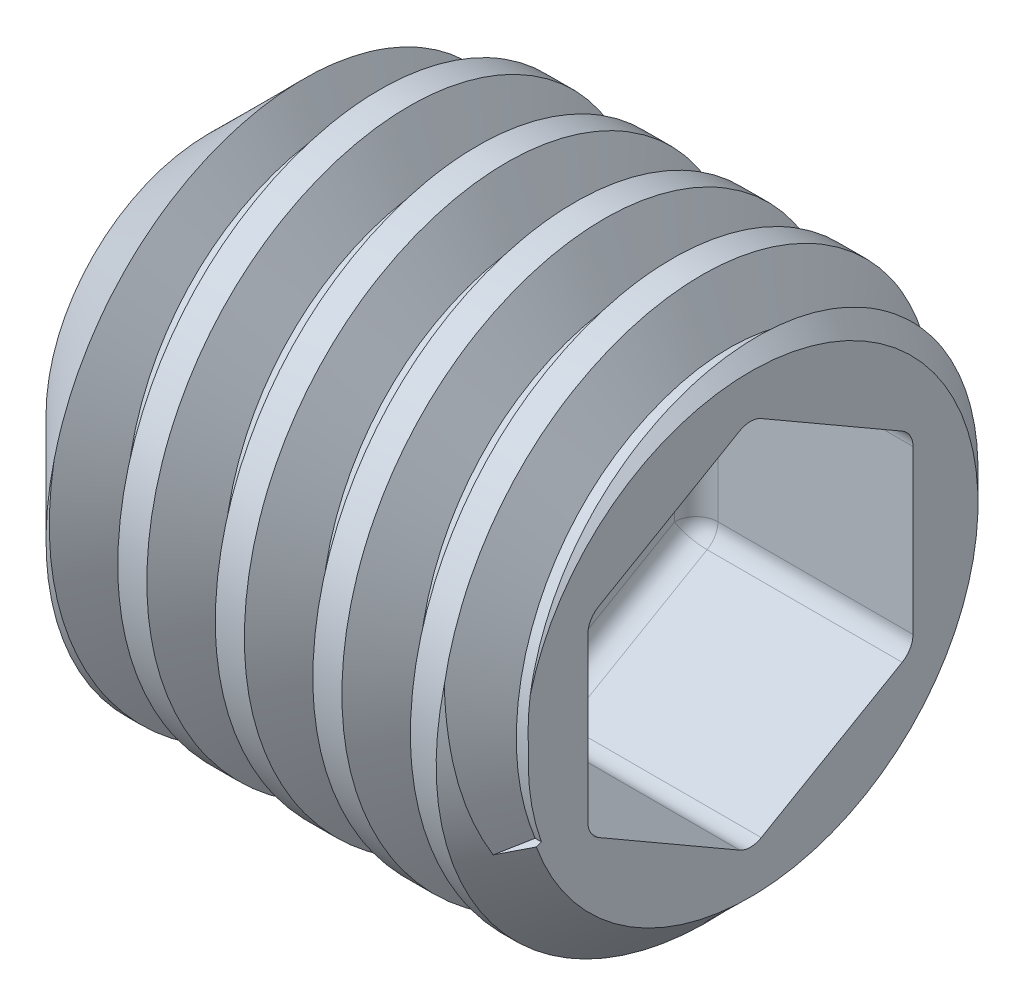
from build123d import *

# Parameters (mm, degrees)
CORTE_EXTRUS_O1_DEPTH     = 1
FILETE1_R                 = 0.1
VARREDURA_DE_CORTE1_PITCH = 0.45


with BuildPart() as part:
    # Esboço1 → Revolução1 (revolve)
    with BuildSketch(Plane.XY, mode=Mode.PRIVATE) as revolu_o1_sk:
        Polygon((0, 0), (2.5, 0), (2.5, 1.05), (2.3, 1.25), (0.5, 1.25), (0, 0.75), align=None)
    revolve(revolu_o1_sk.sketch.rotate(Axis((0, 0, 0), (-1, 0, 0)), 90), axis=Axis((0, 0, 0), (-1, 0, 0)))

    # Esboço2 → Corte-extrusão1 (cut)
    with BuildSketch(Plane(origin=(2.5, 0, 0), x_dir=(0, 0, -1), z_dir=(1, 0, 0))):
        Polygon((0, 0.866025404), (-0.75, 0.433012702), (-0.75, -0.433012702), (0, -0.866025404), (0.75, -0.433012702), (0.75, 0.433012702), align=None)
    extrude(amount=-CORTE_EXTRUS_O1_DEPTH, mode=Mode.SUBTRACT)

    # Filete1
    filete1_edges = [part.edges().sort_by_distance(p)[0] for p in [
        (1.5, 0.649519053, -0.375),
        (2, 0.866025404, 0),
        (1.5, 0, -0.75),
        (2, 0.433012702, -0.75),
        (1.5, -0.649519053, -0.375),
        (2, -0.433012702, -0.75),
        (1.5, -0.649519053, 0.375),
        (2, -0.866025404, 0),
        (1.5, 0, 0.75),
        (2, -0.433012702, 0.75),
        (1.5, 0.649519053, 0.375),
        (2, 0.433012702, 0.75),
    ]]
    fillet(filete1_edges, radius=FILETE1_R)

    # Varredura de corte1: arcs per turn and ends read off the stored shape
    # Varredura de corte1: the profile of Esboço4 profile screwed along a right-hand helix through 5.554978 turns, 6 arcs to a turn; built about Z, then put on its axis
    varredura_de_corte1_z = Axis((0, 0, 0), (0, 0, 1))
    varredura_de_corte1_corners = [(1.025, 0, 0.028125), (1.025, 0, -0.028125), (1.2503, 0, -0.158202016), (1.2497, 0, -0.214278811), (1.285906861, 0, -0.214278811), (1.285906861, 0, 0.214278811), (1.25, 0, 0.214278811), (1.25, 0, 0.158028811)]
    with BuildLine(mode=Mode.PRIVATE) as varredura_de_corte1_profile:
        Line(varredura_de_corte1_corners[0], varredura_de_corte1_corners[1])
        Line(varredura_de_corte1_corners[1], varredura_de_corte1_corners[2])
        Line(varredura_de_corte1_corners[2], varredura_de_corte1_corners[3])
        Line(varredura_de_corte1_corners[3], varredura_de_corte1_corners[4])
        Line(varredura_de_corte1_corners[4], varredura_de_corte1_corners[5])
        Line(varredura_de_corte1_corners[5], varredura_de_corte1_corners[6])
        Line(varredura_de_corte1_corners[6], varredura_de_corte1_corners[7])
        Line(varredura_de_corte1_corners[7], varredura_de_corte1_corners[0])
    varredura_de_corte1_cap = Face(varredura_de_corte1_profile.wire())
    varredura_de_corte1_turn_angles = [0, 30, 60, 90, 120, 150, 180, 210, 240, 270, 300, 330, 360]
    varredura_de_corte1_turn_weights = [1, 0.8660254037844387, 1, 0.8660254037844387, 1, 0.8660254037844387, 1, 0.8660254037844387, 1, 0.8660254037844387, 1, 0.8660254037844387, 1]
    varredura_de_corte1_turn_rails = [Edge.make_bspline([Vector(p[0], p[1], 0).rotate(varredura_de_corte1_z, varredura_de_corte1_turn_angles[k]) / varredura_de_corte1_turn_weights[k] + Vector(0, 0, p[2] + VARREDURA_DE_CORTE1_PITCH * varredura_de_corte1_turn_angles[k] / 360) for k in range(13)], [0, 0, 0, 1, 1, 2, 2, 3, 3, 4, 4, 5, 5, 6, 6, 6], 2, varredura_de_corte1_turn_weights) for p in varredura_de_corte1_corners]
    varredura_de_corte1_turn_sides = [Face.make_surface_from_curves(varredura_de_corte1_turn_rails[p[0]], varredura_de_corte1_turn_rails[p[1]]) for p in [(0, 1), (1, 2), (2, 3), (3, 4), (4, 5), (5, 6), (6, 7), (7, 0)]]
    varredura_de_corte1_last_angles = [1800, 1830, 1860, 1890, 1920, 1950, 1980, 1989.896, 1999.792]
    varredura_de_corte1_last_weights = [1, 0.8660254037844387, 1, 0.8660254037844387, 1, 0.8660254037844387, 1, 0.985121326669632, 1]
    varredura_de_corte1_last_rails = [Edge.make_bspline([Vector(p[0], p[1], 0).rotate(varredura_de_corte1_z, varredura_de_corte1_last_angles[k]) / varredura_de_corte1_last_weights[k] + Vector(0, 0, p[2] + VARREDURA_DE_CORTE1_PITCH * varredura_de_corte1_last_angles[k] / 360) for k in range(9)], [0, 0, 0, 1, 1, 2, 2, 3, 3, 4, 4, 4], 2, varredura_de_corte1_last_weights) for p in varredura_de_corte1_corners]
    varredura_de_corte1_last_sides = [Face.make_surface_from_curves(varredura_de_corte1_last_rails[p[0]], varredura_de_corte1_last_rails[p[1]]) for p in [(0, 1), (1, 2), (2, 3), (3, 4), (4, 5), (5, 6), (6, 7), (7, 0)]]
    varredura_de_corte1 = Plane(origin=(0, 0, 0), x_dir=(0, 0, -1), z_dir=(1, 0, 0)) * Solid(Shell([*[p.moved(Location((0, 0, VARREDURA_DE_CORTE1_PITCH * i))) for i in range(5) for p in varredura_de_corte1_turn_sides], *varredura_de_corte1_last_sides, varredura_de_corte1_cap, varredura_de_corte1_cap.rotate(varredura_de_corte1_z, 1999.792).moved(Location((0, 0, VARREDURA_DE_CORTE1_PITCH * 1999.792 / 360)))]))
    add(varredura_de_corte1, mode=Mode.SUBTRACT)


solid = part.part
